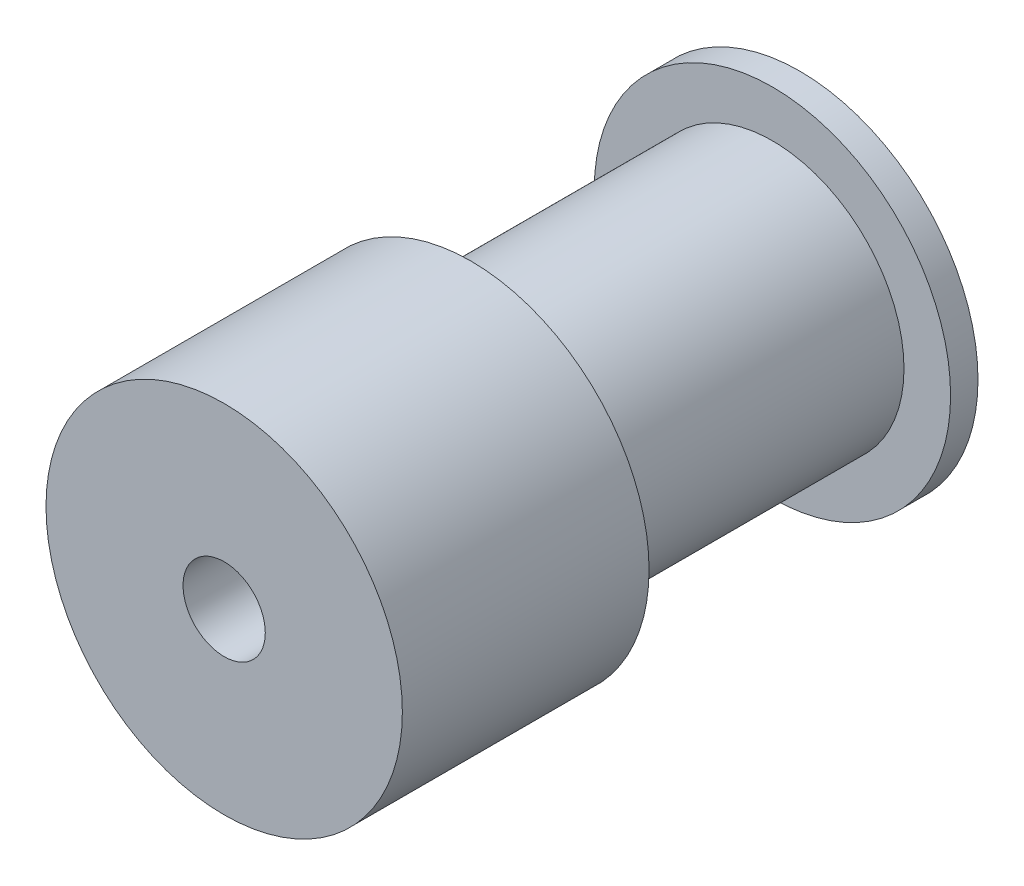
from build123d import *
from build123d.topology import SkipClean

# Parameters (mm, degrees)
SKETCH1_R               = 6.5
SKETCH1_R_2             = 1.5
BOSS_EXTRUDE1_DEPTH     = 1
SKETCH2_R               = 4.8
SKETCH2_R_2             = 1.5
BOSS_EXTRUDE2_DEPTH     = 7
SKETCH3_R               = 6.5
SKETCH3_R_2             = 1.5
BOSS_EXTRUDE3_DEPTH     = 1
CROQUIS2_R              = 6.5
CROQUIS2_R_2            = 1.5
SALIENTE_EXTRUIR1_DEPTH = 12
CROQUIS3_R              = 6.5
CROQUIS3_R_2            = 4.8
CORTAR_EXTRUIR2_DEPTH   = 4


with BuildPart() as part:
    # Sketch1 → Boss-Extrude1 (new body)
    with BuildSketch(Plane.XY):
        Circle(SKETCH1_R)
        Circle(SKETCH1_R_2, mode=Mode.SUBTRACT)
    extrude(amount=BOSS_EXTRUDE1_DEPTH)

    # Sketch2 → Boss-Extrude2 (add)
    with BuildSketch(Plane.XY.offset(1)):
        Circle(SKETCH2_R)
        Circle(SKETCH2_R_2, mode=Mode.SUBTRACT)
    extrude(amount=BOSS_EXTRUDE2_DEPTH)

    # Sketch3 → Boss-Extrude3 (add)
    with BuildSketch(Plane.XY.offset(8)):
        Circle(SKETCH3_R)
        Circle(SKETCH3_R_2, mode=Mode.SUBTRACT)
    extrude(amount=BOSS_EXTRUDE3_DEPTH)

    # Croquis2 → Saliente-Extruir1 (add)
    with BuildSketch(Plane.XY.offset(9)):
        Circle(CROQUIS2_R)
        Circle(CROQUIS2_R_2, mode=Mode.SUBTRACT)
    extrude(amount=SALIENTE_EXTRUIR1_DEPTH)

    # Croquis3 → Cortar-Extruir2 (cut)
    with SkipClean():  # the faces are left unmerged after this step: merging them gives an invalid solid
        with BuildSketch(Plane(origin=(0, 0, 8), x_dir=(-1, 0, 0), z_dir=(0, 0, -1))):
            Circle(CROQUIS3_R)
            Circle(CROQUIS3_R_2, mode=Mode.SUBTRACT)
        extrude(amount=-CORTAR_EXTRUIR2_DEPTH, mode=Mode.SUBTRACT)
    add(part.part.scale(1), mode=Mode.REPLACE)  # the faces are merged on a copy


solid = part.part
